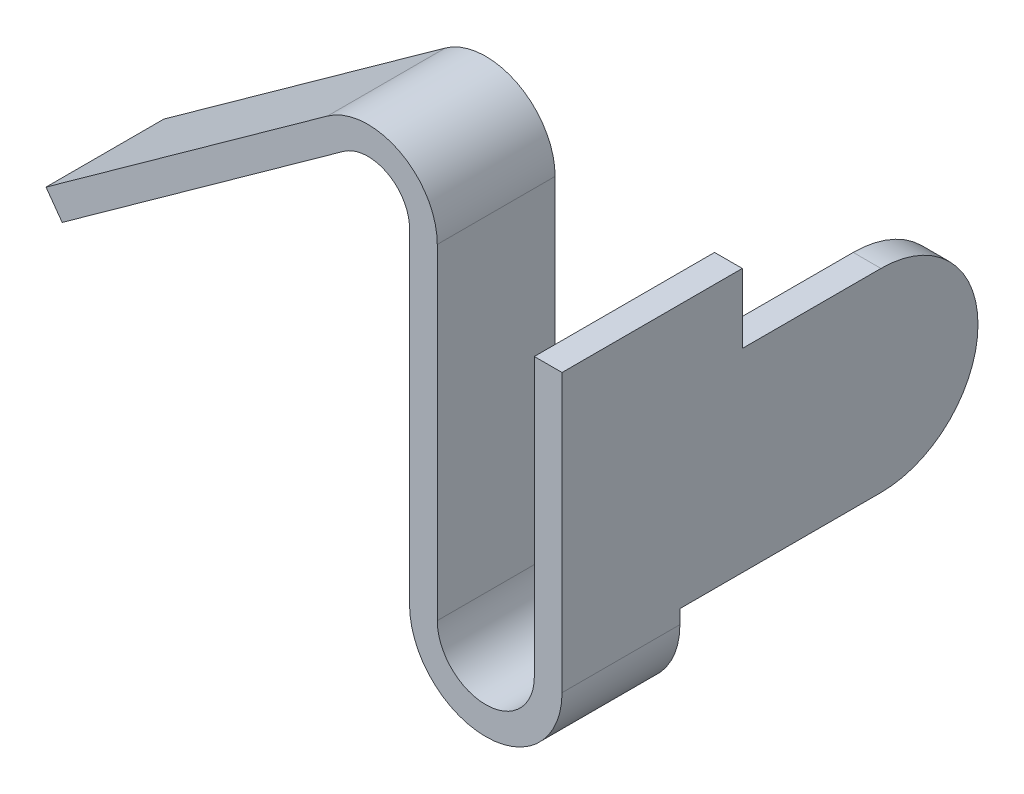
from build123d import *

# Parameters (mm, degrees)
SKETCH1_W           = 0.2
SKETCH1_H           = 1.4
SKETCH1_H_2         = 0.5
BOSS_EXTRUDE1_DEPTH = 0.6
SKETCH1_3_W         = 0.2
SKETCH1_3_H         = 1.4
SKETCH1_3_H_2       = 0.5
BOSS_EXTRUDE2_DEPTH = 0.7
BOSS_EXTRUDE3_START = -0.7
SKETCH1_5_W         = 0.2
SKETCH1_5_H         = 1.4
BOSS_EXTRUDE3_DEPTH = 1.7
FILLET1_R           = 0.7
BOSS_EXTRUDE4_START = -0.25
BOSS_EXTRUDE4_DEPTH = 0.25


with BuildPart() as part:
    # Sketch1 → Boss-Extrude1 (new body)
    with BuildSketch(Plane.XY):
        with BuildLine():
            Line((1.008203317, 1.956023024), (-1.021911803, 0.497039611))
            Line((-1.021911803, 0.497039611), (-0.90519313, 0.334630402))
            Line((-0.90519313, 0.334630402), (1.12492199, 1.793613814))
            ThreePointArc((1.12492199, 1.793613814), (1.436887905, 1.816948874), (1.6, 1.55))
            Line((1.6, 1.55), (1.6, -0.8))
            ThreePointArc((1.6, -0.8), (2.15, -1.35), (2.7, -0.8))
            Line((2.7, -0.8), (2.7, -0.7))
            Line((2.7, -0.7), (2.5, -0.7))
            Line((2.5, -0.7), (2.5, -0.8))
            ThreePointArc((2.5, -0.8), (2.15, -1.15), (1.8, -0.8))
            Line((1.8, -0.8), (1.8, 1.55))
            ThreePointArc((1.8, 1.55), (1.528146509, 1.99491479), (1.008203317, 1.956023024))
        make_face()
        with Locations((2.6, 0)):
            Rectangle(SKETCH1_W, SKETCH1_H)
        with Locations((2.6, 0.95)):
            Rectangle(SKETCH1_W, SKETCH1_H_2)
    extrude(amount=BOSS_EXTRUDE1_DEPTH)

    # Sketch1<3> → Boss-Extrude2 (add)
    with BuildSketch(Plane.XY):
        with Locations((2.6, 0)):
            Rectangle(SKETCH1_3_W, SKETCH1_3_H)
        with Locations((2.6, 0.95)):
            Rectangle(SKETCH1_3_W, SKETCH1_3_H_2)
    extrude(amount=-BOSS_EXTRUDE2_DEPTH)

    # Sketch1<5> → Boss-Extrude3 (add)
    with BuildSketch(Plane.XY.offset(BOSS_EXTRUDE3_START)):
        with Locations((2.6, 0)):
            Rectangle(SKETCH1_5_W, SKETCH1_5_H)
    extrude(amount=-BOSS_EXTRUDE3_DEPTH)

    # Fillet1
    fillet1_edges = [part.edges().sort_by_distance(p)[0] for p in [
        (2.6, 0.7, -2.4),
        (2.6, -0.7, -2.4),
    ]]
    fillet(fillet1_edges, radius=FILLET1_R - 0.0001)  # a hair under: the kernel refuses the full size

    # Sketch1<6> → Boss-Extrude4 (add)
    with BuildSketch(Plane.XY.offset(BOSS_EXTRUDE4_START)):
        with BuildLine():
            Line((1.008203317, 1.956023024), (-1.021911803, 0.497039611))
            Line((-1.021911803, 0.497039611), (-0.90519313, 0.334630402))
            Line((-0.90519313, 0.334630402), (1.12492199, 1.793613814))
            ThreePointArc((1.12492199, 1.793613814), (1.436887905, 1.816948874), (1.6, 1.55))
            Line((1.6, 1.55), (1.6, -0.8))
            ThreePointArc((1.6, -0.8), (2.15, -1.35), (2.7, -0.8))
            Line((2.7, -0.8), (2.7, -0.7))
            Line((2.7, -0.7), (2.5, -0.7))
            Line((2.5, -0.7), (2.5, -0.8))
            ThreePointArc((2.5, -0.8), (2.15, -1.15), (1.8, -0.8))
            Line((1.8, -0.8), (1.8, 1.55))
            ThreePointArc((1.8, 1.55), (1.528146509, 1.99491479), (1.008203317, 1.956023024))
        make_face()
    extrude(amount=BOSS_EXTRUDE4_DEPTH)


solid = part.part
